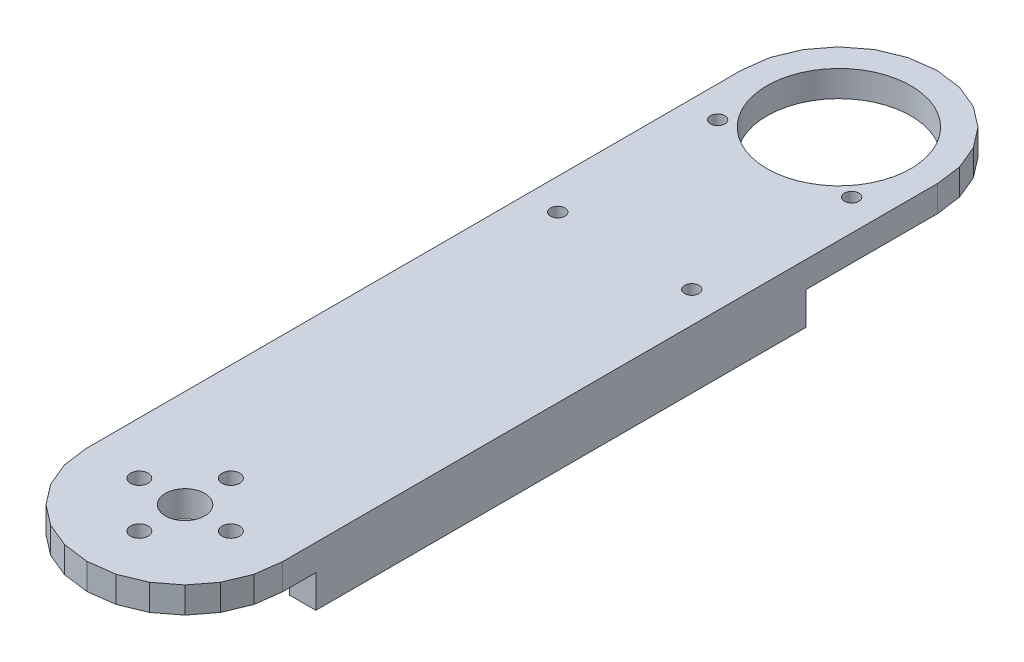
from build123d import *

# Parameters (mm, degrees)
BOSS_1_DEPTH  = 4
S_BOX2_W      = 4
S_BOX2_H      = 5.5
BOSS_2_DEPTH  = 75
S_BOX3_W      = 4
S_BOX3_H      = 5.5
BOSS_3_DEPTH  = 75
S_HOLE4_R     = 3
HOLE_4_DEPTH  = 4.2
S_HOLE5_R     = 1.35
HOLE_5_DEPTH  = 4.2
S_HOLE6_R     = 1.35
HOLE_6_DEPTH  = 4.2
S_HOLE7_R     = 1.35
HOLE_7_DEPTH  = 4.2
S_HOLE8_R     = 1.35
HOLE_8_DEPTH  = 4.2
S_HOLE9_R     = 11
HOLE_9_DEPTH  = 4.2
S_HOLE10_R    = 1.1
HOLE_10_DEPTH = 4.2
S_HOLE11_R    = 1.1
HOLE_11_DEPTH = 4.2
S_HOLE12_R    = 1.1
HOLE_12_DEPTH = 4.2
S_HOLE13_R    = 1.1
HOLE_13_DEPTH = 4.2


with BuildPart() as part:
    # S_prism1 → Boss_1 (new body)
    with BuildSketch(Plane(origin=(0, -22.625, 0), x_dir=(1, 0, 0), z_dir=(0, 1, 0))):
        Polygon((-15, -0.1), (-14.492, -3.956), (-13.004, -7.55), (-10.636, -10.636), (-7.55, -13.004), (-3.956, -14.492), (-0.1, -15), (0.1, -15), (3.956, -14.492), (7.55, -13.004), (10.636, -10.636), (13.004, -7.55), (14.492, -3.956), (15, -0.1), (15, 100.1), (14.492, 103.956), (13.004, 107.55), (10.636, 110.636), (7.55, 113.004), (3.956, 114.492), (0.1, 115), (-0.1, 115), (-3.956, 114.492), (-7.55, 113.004), (-10.636, 110.636), (-13.004, 107.55), (-14.492, 103.956), (-15, 100.1), align=None)
    extrude(amount=BOSS_1_DEPTH)

    # S_box2 → Boss_2 (add)
    with BuildSketch(Plane.XY.offset(-80)):
        with Locations((-13, -24.875)):
            Rectangle(S_BOX2_W, S_BOX2_H)
    extrude(amount=BOSS_2_DEPTH)

    # S_box3 → Boss_3 (add)
    with BuildSketch(Plane.XY.offset(-80)):
        with Locations((13, -24.875)):
            Rectangle(S_BOX3_W, S_BOX3_H)
    extrude(amount=BOSS_3_DEPTH)

    # S_hole4 → Hole_4 (cut)
    with BuildSketch(Plane(origin=(0, -22.725, 0), x_dir=(1, 0, 0), z_dir=(0, 1, 0))):
        Circle(S_HOLE4_R)
    extrude(amount=HOLE_4_DEPTH, mode=Mode.SUBTRACT)

    # S_hole5 → Hole_5 (cut)
    with BuildSketch(Plane(origin=(0, -22.725, 0), x_dir=(1, 0, 0), z_dir=(0, 1, 0))):
        with Locations((7, 0)):
            Circle(S_HOLE5_R)
    extrude(amount=HOLE_5_DEPTH, mode=Mode.SUBTRACT)

    # S_hole6 → Hole_6 (cut)
    with BuildSketch(Plane(origin=(0, -22.725, 0), x_dir=(1, 0, 0), z_dir=(0, 1, 0))):
        with Locations((0, -7)):
            Circle(S_HOLE6_R)
    extrude(amount=HOLE_6_DEPTH, mode=Mode.SUBTRACT)

    # S_hole7 → Hole_7 (cut)
    with BuildSketch(Plane(origin=(0, -22.725, 0), x_dir=(1, 0, 0), z_dir=(0, 1, 0))):
        with Locations((-7, 0)):
            Circle(S_HOLE7_R)
    extrude(amount=HOLE_7_DEPTH, mode=Mode.SUBTRACT)

    # S_hole8 → Hole_8 (cut)
    with BuildSketch(Plane(origin=(0, -22.725, 0), x_dir=(1, 0, 0), z_dir=(0, 1, 0))):
        with Locations((0, 7)):
            Circle(S_HOLE8_R)
    extrude(amount=HOLE_8_DEPTH, mode=Mode.SUBTRACT)

    # S_hole9 → Hole_9 (cut)
    with BuildSketch(Plane(origin=(0, -22.725, 0), x_dir=(1, 0, 0), z_dir=(0, 1, 0))):
        with Locations((0, 100)):
            Circle(S_HOLE9_R)
    extrude(amount=HOLE_9_DEPTH, mode=Mode.SUBTRACT)

    # S_hole10 → Hole_10 (cut)
    with BuildSketch(Plane(origin=(0, -22.725, 0), x_dir=(1, 0, 0), z_dir=(0, 1, 0))):
        with Locations((-10.25, 91.7)):
            Circle(S_HOLE10_R)
    extrude(amount=HOLE_10_DEPTH, mode=Mode.SUBTRACT)

    # S_hole11 → Hole_11 (cut)
    with BuildSketch(Plane(origin=(0, -22.725, 0), x_dir=(1, 0, 0), z_dir=(0, 1, 0))):
        with Locations((10.25, 91.7)):
            Circle(S_HOLE11_R)
    extrude(amount=HOLE_11_DEPTH, mode=Mode.SUBTRACT)

    # S_hole12 → Hole_12 (cut)
    with BuildSketch(Plane(origin=(0, -22.725, 0), x_dir=(1, 0, 0), z_dir=(0, 1, 0))):
        with Locations((-10.25, 67.25)):
            Circle(S_HOLE12_R)
    extrude(amount=HOLE_12_DEPTH, mode=Mode.SUBTRACT)

    # S_hole13 → Hole_13 (cut)
    with BuildSketch(Plane(origin=(0, -22.725, 0), x_dir=(1, 0, 0), z_dir=(0, 1, 0))):
        with Locations((10.25, 67.25)):
            Circle(S_HOLE13_R)
    extrude(amount=HOLE_13_DEPTH, mode=Mode.SUBTRACT)


solid = part.part
